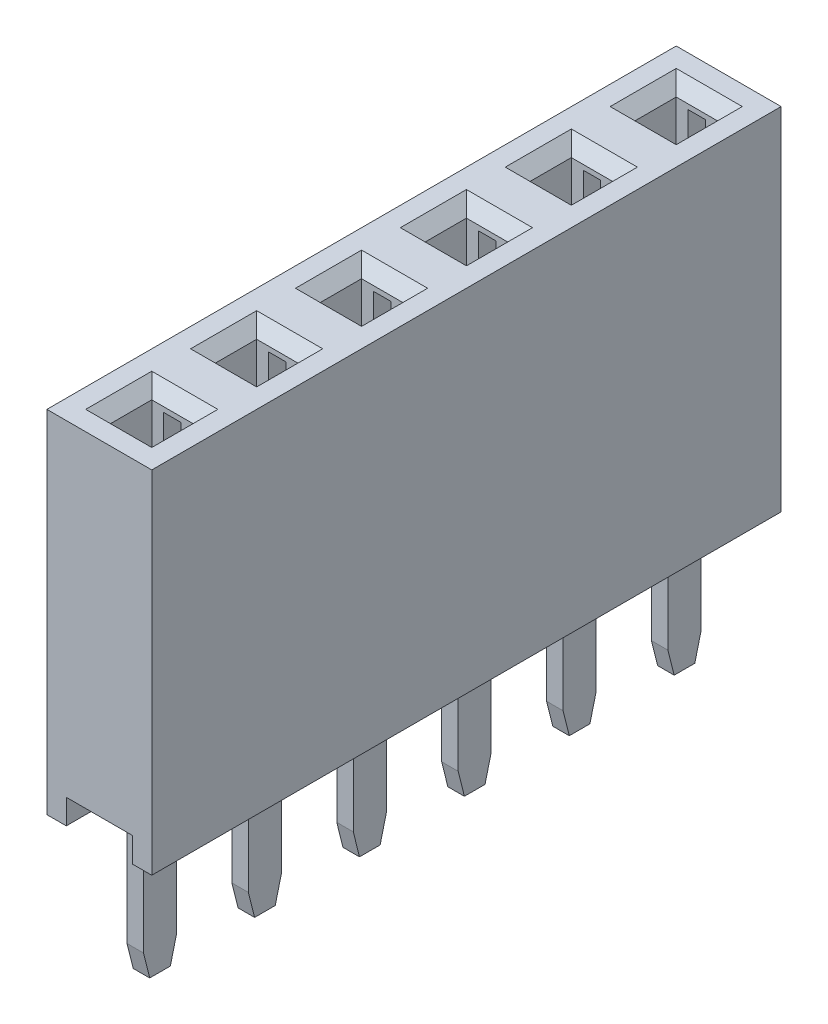
from build123d import *

# Parameters (mm, degrees)
DODANIE_WYCI_GNI_CIE1_DEPTH  = 2.54
SZKIC2_W                     = 1
SZKIC2_H                     = 1
WYTNIJ_WYCI_GNI_CIE1_DEPTH   = 6.5
SFAZOWANIE1_SIZE             = 0.3
SZKIC3_W                     = 0.42
SZKIC3_H                     = 2
WYTNIJ_WYCI_GNI_CIE2_DEPTH   = 7.48
F_1_0_START                  = 5.308321595
F_1_0_METAL_DEPTH            = 0.4
OBIEKT_PRZENIE_KOPIUJ4_ANGLE = 90
SZYK_LINIOWY1_COUNT          = 6
SZYK_LINIOWY1_PITCH          = 2.54


with BuildPart() as part:
    # Szkic1 → Dodanie-wyciągnięcie1 (new body)
    with BuildSketch(Plane.XY):
        Polygon((-60.643223432, 20.119077877), (-60.173223432, 20.119077877), (-60.173223432, 20.719077877), (-58.573223432, 20.719077877), (-58.573223432, 20.119077877), (-58.103223432, 20.119077877), (-58.103223432, 28.619077877), (-60.643223432, 28.619077877), align=None)
    extrude(amount=DODANIE_WYCI_GNI_CIE1_DEPTH)

    # Szkic2 → Wytnij-wyciągnięcie1 (cut)
    with BuildSketch(Plane(origin=(0, 28.619077877, 0), x_dir=(1, 0, 0), z_dir=(0, 1, 0))):
        with Locations((-59.373223432, -1.27)):
            Rectangle(SZKIC2_W, SZKIC2_H)
    extrude(amount=-WYTNIJ_WYCI_GNI_CIE1_DEPTH, mode=Mode.SUBTRACT)

    # Sfazowanie1
    sfazowanie1_edges = [part.edges().sort_by_distance(p)[0] for p in [
        (-59.873223432, 28.619077877, 1.27),
        (-59.373223432, 28.619077877, 1.77),
        (-58.873223432, 28.619077877, 1.27),
        (-59.373223432, 28.619077877, 0.77),
    ]]
    chamfer(sfazowanie1_edges, length=SFAZOWANIE1_SIZE)

    # Szkic3 → Wytnij-wyciągnięcie2 (cut)
    with BuildSketch(Plane.XZ.offset(-20.719077877)):
        with Locations((-59.373223432, 1.27)):
            Rectangle(SZKIC3_W, SZKIC3_H)
    extrude(amount=-WYTNIJ_WYCI_GNI_CIE2_DEPTH, mode=Mode.SUBTRACT)


with BuildPart() as body_2:
    # 1.0 metal: read off the stored shape, not the designer's step
    # 1.0 metal outline → 1.0 metal (new body)
    with BuildSketch(Plane.XY.offset(F_1_0_START)):
        with BuildLine():
            Line((-59.545144592, 19.33476682), (-59.045144592, 19.33476682))
            Line((-59.045144592, 19.33476682), (-58.895144592, 19.93476682))
            Line((-58.895144592, 19.93476682), (-58.895144592, 23.13476682))
            Line((-58.895144592, 23.13476682), (-58.695144592, 23.13476682))
            Line((-58.695144592, 23.13476682), (-58.295144592, 23.38476682))
            Line((-58.295144592, 23.38476682), (-58.295144592, 25.13476682))
            Line((-58.295144592, 25.13476682), (-58.481811258, 28.63476682))
            Line((-58.481811258, 28.63476682), (-58.845144592, 29.28476682))
            Line((-58.845144592, 29.28476682), (-58.995144592, 28.88476682))
            Line((-58.995144592, 28.88476682), (-58.795144592, 25.13476682))
            Line((-58.795144592, 25.13476682), (-58.795144592, 24.23476682))
            ThreePointArc((-58.795144592, 24.23476682), (-59.295144592, 23.73476682), (-59.795144592, 24.23476682))
            Line((-59.795144592, 24.23476682), (-59.795144592, 25.13476682))
            Line((-59.795144592, 25.13476682), (-59.595144592, 28.88476682))
            Line((-59.595144592, 28.88476682), (-59.745144592, 29.28476682))
            Line((-59.745144592, 29.28476682), (-60.108477925, 28.63476682))
            Line((-60.108477925, 28.63476682), (-60.295144592, 25.13476682))
            Line((-60.295144592, 25.13476682), (-60.295144592, 23.38476682))
            Line((-60.295144592, 23.38476682), (-59.895144592, 23.13476682))
            Line((-59.895144592, 23.13476682), (-59.695144592, 23.13476682))
            Line((-59.695144592, 23.13476682), (-59.695144592, 19.93476682))
            Line((-59.695144592, 19.93476682), (-59.545144592, 19.33476682))
        make_face()
    extrude(amount=F_1_0_METAL_DEPTH)


with BuildPart() as body_2_1:
    # Obiekt-Przenieś/Kopiuj4: read off the stored shape, not the designer's step
    # Obiekt-Przenieś/Kopiuj4: moved
    add(body_2.part.moved(Location((58.0251446, -2.4156889, -64.881545))).rotate(Axis((0, 0, 0), (0, 1, 0)), OBIEKT_PRZENIE_KOPIUJ4_ANGLE))


with BuildPart() as szyk_liniowy1_1:
    # Szyk liniowy1: pattern copy
    add(body_2_1.part.moved(Location(Vector(0, 0, -1) * (1 * SZYK_LINIOWY1_PITCH))))


with BuildPart() as szyk_liniowy1_2:
    # Szyk liniowy1: pattern copy
    add(body_2_1.part.moved(Location(Vector(0, 0, -1) * (2 * SZYK_LINIOWY1_PITCH))))


with BuildPart() as szyk_liniowy1_3:
    # Szyk liniowy1: pattern copy
    add(body_2_1.part.moved(Location(Vector(0, 0, -1) * (3 * SZYK_LINIOWY1_PITCH))))


with BuildPart() as szyk_liniowy1_4:
    # Szyk liniowy1: pattern copy
    add(body_2_1.part.moved(Location(Vector(0, 0, -1) * (4 * SZYK_LINIOWY1_PITCH))))


with BuildPart() as szyk_liniowy1_5:
    # Szyk liniowy1: pattern copy
    add(body_2_1.part.moved(Location(Vector(0, 0, -1) * (5 * SZYK_LINIOWY1_PITCH))))


with BuildPart() as szyk_liniowy1_6:
    # Szyk liniowy1: pattern copy
    add(part.part.moved(Location(Vector(0, 0, -1) * (1 * SZYK_LINIOWY1_PITCH))))


with BuildPart() as szyk_liniowy1_7:
    # Szyk liniowy1: pattern copy
    add(part.part.moved(Location(Vector(0, 0, -1) * (2 * SZYK_LINIOWY1_PITCH))))


with BuildPart() as szyk_liniowy1_8:
    # Szyk liniowy1: pattern copy
    add(part.part.moved(Location(Vector(0, 0, -1) * (3 * SZYK_LINIOWY1_PITCH))))


with BuildPart() as szyk_liniowy1_9:
    # Szyk liniowy1: pattern copy
    add(part.part.moved(Location(Vector(0, 0, -1) * (4 * SZYK_LINIOWY1_PITCH))))


with BuildPart() as szyk_liniowy1_10:
    # Szyk liniowy1: pattern copy
    add(part.part.moved(Location(Vector(0, 0, -1) * (5 * SZYK_LINIOWY1_PITCH))))


with BuildPart() as part_1:
    add(part.part)

    # Połącz1: union Szyk liniowy1_6, Szyk liniowy1_7, Szyk liniowy1_8, Szyk liniowy1_9, Szyk liniowy1_10
    add(szyk_liniowy1_6.part)
    add(szyk_liniowy1_7.part)
    add(szyk_liniowy1_8.part)
    add(szyk_liniowy1_9.part)
    add(szyk_liniowy1_10.part)


solid = Compound([body_2_1.part, szyk_liniowy1_1.part, szyk_liniowy1_2.part, szyk_liniowy1_3.part, szyk_liniowy1_4.part, szyk_liniowy1_5.part, part_1.part])
